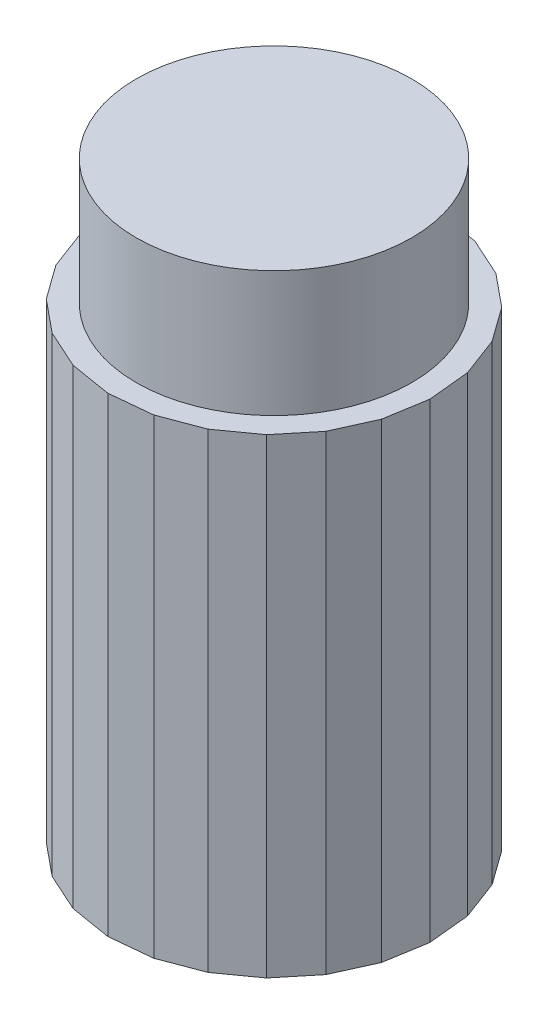
from build123d import *

# Parameters (mm, degrees)
EXTRUDE_1_DEPTH = 150
SKETCH_2_R      = 43.899905366
EXTRUDE_2_DEPTH = 40


with BuildPart() as part:
    # Эскиз1 → Бобышка-Вытянуть1 (new body)
    with BuildSketch(Plane(origin=(0, 0, 0), x_dir=(1, 0, 0), z_dir=(0, 1, 0))):
        Polygon((1.652375369, 51.334951977), (-11.690391207, 50.013422121), (-24.236476942, 45.283560199), (-35.130886826, 37.467698484), (-43.63118483, 27.098475035), (-49.158089691, 14.882535295), (-51.334951977, 1.652375369), (-50.013422121, -11.690391207), (-45.283560199, -24.236476942), (-37.467698484, -35.130886826), (-27.098475035, -43.63118483), (-14.882535295, -49.158089691), (-1.652375369, -51.334951977), (11.690391207, -50.013422121), (24.236476942, -45.283560199), (35.130886826, -37.467698484), (43.63118483, -27.098475035), (49.158089691, -14.882535295), (51.334951977, -1.652375369), (50.013422121, 11.690391207), (45.283560199, 24.236476942), (37.467698484, 35.130886826), (27.098475035, 43.63118483), (14.882535295, 49.158089691), align=None)
    extrude(amount=EXTRUDE_1_DEPTH)

    # Эскиз2 → Бобышка-Вытянуть2 (add)
    with BuildSketch(Plane(origin=(0, 150, 0), x_dir=(1, 0, 0), z_dir=(0, 1, 0))):
        Circle(SKETCH_2_R)
    extrude(amount=EXTRUDE_2_DEPTH)


solid = part.part
